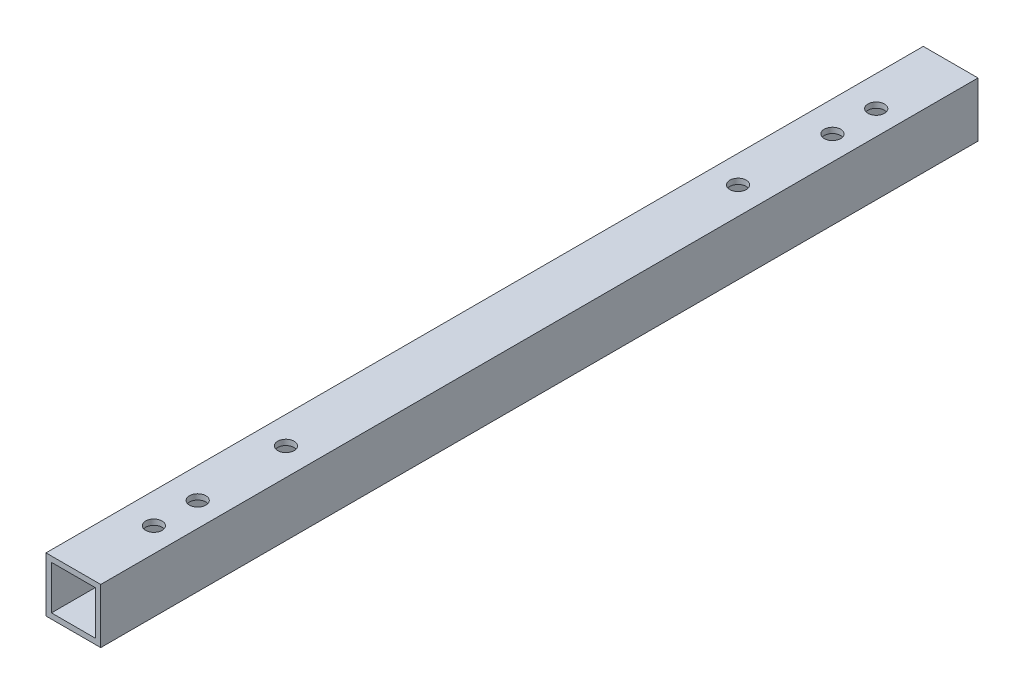
from build123d import *

# Parameters (mm, degrees)
SKETCH_1_W      = 10
SKETCH_1_H      = 10
SKETCH_1_W_2    = 8
SKETCH_1_H_2    = 8
EXTRUDE_1_DEPTH = 80.155
HOLE_WIZARD_1_D = 3
HOLE_WIZARD_2_D = 3


with BuildPart() as part:
    # 草图1 → 凸台-拉伸1 (new, symmetric)
    with BuildSketch(Plane.XY):
        Rectangle(SKETCH_1_W, SKETCH_1_H)
        Rectangle(SKETCH_1_W_2, SKETCH_1_H_2, mode=Mode.SUBTRACT)
    extrude(amount=EXTRUDE_1_DEPTH, both=True)

    # 孔1 (through all)
    with Locations(Plane(origin=(0, -5, 0), x_dir=(-1, 0, 0), z_dir=(0, -1, 0))):
        with Locations((0.003475522, -41.312740983), (0.003475522, 41.312740983)):
            Hole(HOLE_WIZARD_1_D / 2)

    # 孔2 (through all)
    with Locations(Plane(origin=(0, 5, 0), x_dir=(1, 0, 0), z_dir=(0, 1, 0))):
        with Locations((0.556399926, 66), (0.556399926, 58), (0.563600074, -58), (0.556399926, -66)):
            Hole(HOLE_WIZARD_2_D / 2)


solid = part.part
